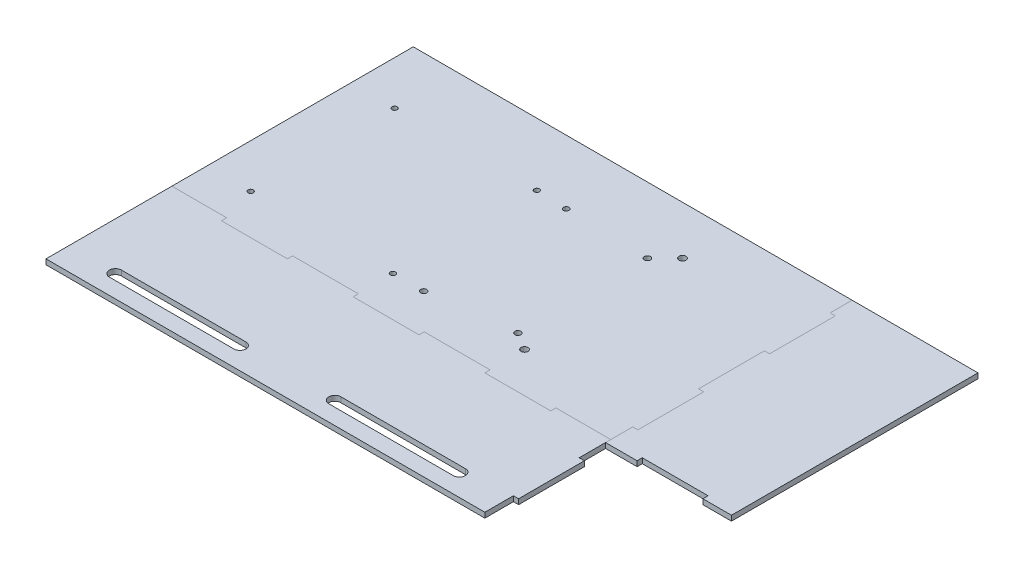
from build123d import *

# Parameters (mm, degrees)
BOSS_EXTRUDE1_DEPTH = 3
BOSS_EXTRUDE2_DEPTH = 3
BOSS_EXTRUDE3_DEPTH = 3
CUT_EXTRUDE1_DEPTH  = 3
SKETCH5_R           = 1.5
SKETCH5_R_2         = 1.75
SKETCH5_R_3         = 1.588777233
SKETCH5_R_4         = 2
CUT_EXTRUDE2_DEPTH  = 3


with BuildPart() as part:
    # Sketch1 → Boss-Extrude1 (new body)
    with BuildSketch(Plane(origin=(0, 0, 0), x_dir=(1, 0, 0), z_dir=(0, 1, 0))):
        Polygon((0, 0), (31.75, 0), (31.75, -3), (69.85, -3), (69.85, 0), (107.95, 0), (107.95, -3), (146.05, -3), (146.05, 0), (184.15, 0), (184.15, -3), (222.25, -3), (222.25, 0), (254, 0), (254, 12.7), (257, 12.7), (257, 50.8), (254, 50.8), (254, 88.9), (257, 88.9), (257, 127), (254, 127), (254, 139.7), (0, 139.7), align=None)
    extrude(amount=BOSS_EXTRUDE1_DEPTH)

    # Sketch5 → Cut-Extrude2 (cut)
    with BuildSketch(Plane(origin=(0, 3, 0), x_dir=(1, 0, 0), z_dir=(0, 1, 0))):
        with Locations((25.4, 20.207792239)):
            Circle(SKETCH5_R)
        with Locations((25.4, 103.519792239)):
            Circle(SKETCH5_R)
        with Locations((107.7, 20.207792239)):
            Circle(SKETCH5_R)
        with Locations((107.7, 103.519792239)):
            Circle(SKETCH5_R)
        with Locations((173.74, 101.487792239)):
            Circle(SKETCH5_R_2)
        with Locations((173.74, 26.557792239)):
            Circle(SKETCH5_R_2)
        with Locations((125.48, 20.207792239)):
            Circle(SKETCH5_R_2)
        with Locations((125.48, 102.757792239)):
            Circle(SKETCH5_R_3)
        with Locations((183.9, 111.647792239)):
            Circle(SKETCH5_R_4)
        with Locations((183.9, 20.207792239)):
            Circle(SKETCH5_R_4)
    extrude(amount=-CUT_EXTRUDE2_DEPTH, mode=Mode.SUBTRACT)


with BuildPart() as body_2:
    # Sketch2 → Boss-Extrude2 (new body)
    with BuildSketch(Plane(origin=(0, 0, 0), x_dir=(1, 0, 0), z_dir=(0, 1, 0))):
        Polygon((0, 0), (31.75, 0), (31.75, -3), (69.85, -3), (69.85, 0), (107.95, 0), (107.95, -3), (146.05, -3), (146.05, 0), (184.15, 0), (184.15, -3), (222.25, -3), (222.25, 0), (254, 0), (254, -18.24), (257, -18.24), (257, -56.34), (254, -56.34), (254, -72.85), (0, -72.85), align=None)
    extrude(amount=BOSS_EXTRUDE2_DEPTH)

    # Sketch4 → Cut-Extrude1 (cut)
    with BuildSketch(Plane(origin=(0, 3, 0), x_dir=(1, 0, 0), z_dir=(0, 1, 0))):
        with BuildLine():
            Line((27.455356566, -56.650000015), (99.544643434, -56.650000015))
            ThreePointArc((99.544643434, -56.650000015), (103.044643419, -60.15), (99.544643434, -63.649999985))
            Line((99.544643434, -63.649999985), (27.455356566, -63.649999985))
            ThreePointArc((27.455356566, -63.649999985), (23.955356581, -60.15), (27.455356566, -56.650000015))
        make_face()
        with BuildLine():
            Line((226.544643434, -56.650000015), (154.455356566, -56.650000015))
            ThreePointArc((154.455356566, -56.650000015), (150.955356581, -60.15), (154.455356566, -63.649999985))
            Line((154.455356566, -63.649999985), (226.544643434, -63.649999985))
            ThreePointArc((226.544643434, -63.649999985), (230.044643419, -60.15), (226.544643434, -56.650000015))
        make_face()
    extrude(amount=-CUT_EXTRUDE1_DEPTH, mode=Mode.SUBTRACT)


with BuildPart() as body_3:
    # Sketch3 → Boss-Extrude3 (new body)
    with BuildSketch(Plane(origin=(0, 0, 0), x_dir=(1, 0, 0), z_dir=(0, 1, 0))):
        Polygon((254, -3), (254, 12.7), (257.000000096, 12.7), (257.000000096, 50.8), (254, 50.8), (254, 88.9), (257.000000096, 88.9), (257.000000096, 127), (254, 127), (254, 139.7), (326.85, 139.7), (326.85, -3), (310.34, -3), (310.34, 9.6e-08), (272.24, 9.6e-08), (272.24, -3), align=None)
    extrude(amount=BOSS_EXTRUDE3_DEPTH)


solid = Compound([part.part, body_2.part, body_3.part])
